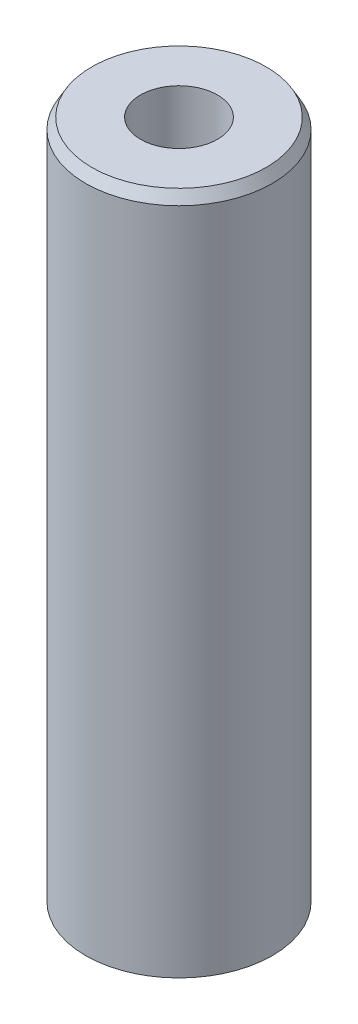
from build123d import *
from OCP.BRepFilletAPI import BRepFilletAPI_MakeChamfer

# Parameters (mm, degrees)
SKETCH1_R           = 47.5
BOSS_EXTRUDE1_DEPTH = 348.7557073
SKETCH2_R           = 19.574551042
CUT_EXTRUDE1_DEPTH  = 356.16621936
CHAMFER1_SIZE       = 5.4607904
CHAMFER1_SIZE2      = 3.152788807


with BuildPart() as part:
    # Sketch1 → Boss-Extrude1 (new body)
    with BuildSketch(Plane(origin=(0, 0, 0), x_dir=(1, 0, 0), z_dir=(0, 1, 0))):
        Circle(SKETCH1_R)
    extrude(amount=BOSS_EXTRUDE1_DEPTH)

    # Sketch2 → Cut-Extrude1 (cut, through all)
    with BuildSketch(Plane(origin=(0, 0, 0), x_dir=(1, 0, 0), z_dir=(0, 1, 0))):
        Circle(SKETCH2_R)
    extrude(amount=CUT_EXTRUDE1_DEPTH, mode=Mode.SUBTRACT)

    # Chamfer1: one chamfer whose edges measure the first distance from different faces: ONE call of the kernel's chamfer builder (chamfer() names one face for all edges)
    chamfer1_edges_1 = [part.edges().sort_by_distance(p)[0] for p in [
        (-47.5, 348.7557073, 0),
    ]]
    chamfer1_side_1 = [part.faces().sort_by_distance(p)[0] for p in [
        (-47.5, 174.37785365, 0),
    ]]
    chamfer1_edges_2 = [part.edges().sort_by_distance(p)[0] for p in [
        (-47.5, 0, 0),
    ]]
    chamfer1_side_2 = [part.faces().sort_by_distance(p)[0] for p in [
        (-46.156497116, 0, 0),
    ]]
    chamfer1 = BRepFilletAPI_MakeChamfer(part.part.solid().wrapped)
    for e in chamfer1_edges_1:
        chamfer1.Add(CHAMFER1_SIZE, CHAMFER1_SIZE2, e.wrapped, chamfer1_side_1[0].wrapped)  # the first distance lies on this face
    for e in chamfer1_edges_2:
        chamfer1.Add(CHAMFER1_SIZE, CHAMFER1_SIZE2, e.wrapped, chamfer1_side_2[0].wrapped)  # the first distance lies on this face
    add(Compound.cast(chamfer1.Shape()), mode=Mode.REPLACE)


solid = part.part
